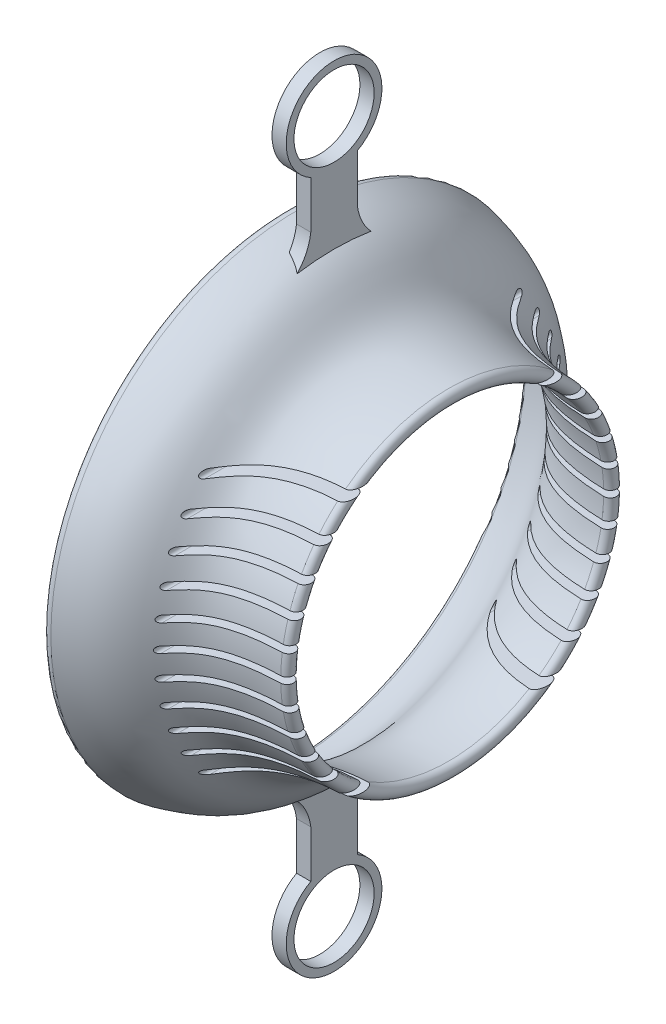
from build123d import *

# Parameters (mm, degrees)
REVOLVE1_OUTLINE_W      = 2.435977989
REVOLVE1_OUTLINE_H      = 0.562148767
REVOLVE1_OUTLINE_W_2    = 2.499054311
REVOLVE1_OUTLINE_H_2    = 0.068757178
SKETCH2_R               = 7.75
BOSS_EXTRUDE1_DEPTH     = 1.375
CUT_EXTRUDE1_DEPTH      = 178.547385118
CUT_EXTRUDE1_DEPTH_BACK = 178.547385118


# Read off the part's stored shape, not the designer's step: Revolve1
with BuildPart() as part:
    # Revolve1 outline → Revolve1 (revolve)
    with BuildSketch(Plane(origin=(0, 42.196632642, 0), x_dir=(0, 1, 0), z_dir=(0, 0, -1))):
        with BuildLine():
            Line((47.435977989, 29.5), (45, 29.5))
            ThreePointArc((45, 29.5), (45.439799744, 28.802850744), (46.217988994, 28.531074384))
            ThreePointArc((46.217988994, 28.531074384), (46.996178245, 28.802850744), (47.435977989, 29.5))
        make_face()
        with Locations((46.217988995, 29.781074384)):
            Rectangle(REVOLVE1_OUTLINE_W, REVOLVE1_OUTLINE_H)
        with BuildLine():
            add(Edge.make_bspline(
                [(45, 29.5), (44.967619341, 29.64031619), (44.934939862, 29.780863156), (44.901881306, 29.921512917), (44.868369225, 30.062148767)],
                knots=[0, 0, 0, 0, 0, 0.021587106, 0.021587106, 0.021587106, 0.021587106, 0.021587106], degree=4))
            Line((45, 29.5), (45, 30.062148767))
            Line((45, 30.062148767), (44.868369225, 30.062148767))
        make_face()
        with BuildLine():
            add(Edge.make_bspline(
                [(44.868369225, 30.062148767), (43.671503185, 35.084882868), (41.896155733, 40.089872991), (36.150916363, 39.760600145), (32.499054311, 47.12340222)],
                knots=[0.021587106, 0.021587106, 0.021587106, 0.021587106, 0.021587106, 0.792559045, 0.792559045, 0.792559045, 0.792559045, 0.792559045], degree=4))
            Line((44.868369225, 30.062148767), (45, 30.062148767))
            Line((45, 30.062148767), (45, 36.895785477))
            add(Edge.make_bspline(
                [(32.500991417, 59.5), (32.512462881, 59.102110558), (32.545797682, 58.269052785), (32.645824483, 56.726958765), (32.83403897, 54.944805828), (33.141937566, 53.088067614), (33.642616847, 50.939980903), (34.401653884, 48.806032662), (35.435939492, 46.898644089), (36.551283461, 45.424962453), (38.13715071, 43.801918002), (40.300334427, 42.092629768), (42.931490645, 39.847261346), (44.396824762, 37.927596666), (45, 36.895785477)],
                knots=[0.000851873, 0.000851873, 0.000851873, 0.000851873, 0.015625, 0.03125, 0.0625, 0.09375, 0.125, 0.1875, 0.25, 0.3125, 0.375, 0.5, 0.625, 0.747925865, 0.747925865, 0.747925865, 0.747925865], degree=3))
            Line((32.500991417, 59.5), (32.499054311, 59.5))
            Line((32.499054311, 59.5), (32.499054311, 47.12340222))
        make_face()
        with BuildLine():
            Line((47.435977989, 30.062148767), (47.435977989, 29.5))
            ThreePointArc((47.435977989, 29.5), (47.45996046, 29.639628711), (47.467988994, 29.781074384))
            ThreePointArc((47.467988994, 29.781074384), (47.45996046, 29.922520056), (47.435977989, 30.062148767))
        make_face()
        with BuildLine():
            Line((45, 36.895785477), (45, 30.062148767))
            Line((45, 30.062148767), (47.435977989, 30.062148767))
            add(Edge.make_bspline(
                [(45, 36.895785477), (45.010177411, 36.878375668), (45.631555726, 35.81034931), (46.360443593, 34.090145), (47.037288625, 31.751965256), (47.304651212, 30.631231468), (47.435977989, 30.062148767)],
                knots=[0.747925865, 0.747925865, 0.747925865, 0.747925865, 0.75, 0.875, 0.9375, 1, 1, 1, 1], degree=3))
        make_face()
        with BuildLine():
            add(Edge.make_bspline(
                [(32.499054311, 47.12340222), (31.516468937, 49.104468734), (30.685434763, 51.642407231), (30.124058518, 54.99095841), (30, 59.5)],
                knots=[0.792559045, 0.792559045, 0.792559045, 0.792559045, 0.792559045, 1, 1, 1, 1, 1], degree=4))
            Line((32.499054311, 47.12340222), (32.499054311, 59.5))
            Line((32.499054311, 59.5), (30, 59.5))
        make_face()
        with Locations((31.249527156, 59.534378589)):
            Rectangle(REVOLVE1_OUTLINE_W_2, REVOLVE1_OUTLINE_H_2)
        with BuildLine():
            ThreePointArc((30, 59.568757178), (29.999527156, 59.534378589), (30, 59.5))
            Line((30, 59.5), (30, 59.568757178))
        make_face()
        with BuildLine():
            Line((32.499054311, 59.568757178), (32.499054311, 59.5))
            Line((32.499054311, 59.5), (32.500991417, 59.5))
            add(Edge.make_bspline(
                [(32.499054311, 59.568757178), (32.499684167, 59.545864368), (32.50032993, 59.522943766), (32.500991417, 59.5)],
                knots=[0, 0, 0, 0, 0.000851873, 0.000851873, 0.000851873, 0.000851873], degree=3))
        make_face()
        with BuildLine():
            ThreePointArc((31.249527156, 60.784378588), (30.377883087, 60.430334289), (30, 59.568757178))
            Line((30, 59.568757178), (32.499054311, 59.568757178))
            ThreePointArc((32.499054311, 59.568757178), (32.121171224, 60.43033429), (31.249527156, 60.784378588))
        make_face()
    revolve(axis=Axis((0, 42.196632642, 0), (1, 0, 0)))

    # Sketch2 → Boss-Extrude1 (add, symmetric)
    # profile 1 of 2: a face of its own
    with BuildSketch(Plane(origin=(36, 0, 0), x_dir=(0, 0, -1), z_dir=(1, 0, 0))):
        with BuildLine():
            Line((4.5, 91.975938839), (4.5, 101.115017705))
            ThreePointArc((4.5, 101.115017705), (0, 118.446632642), (-4.5, 101.115017705))
            Line((-4.5, 101.115017705), (-4.5, 91.975938839))
            ThreePointArc((-4.5, 91.975938839), (-6.073090554, 87.685507916), (-9.39067779, 84.542893347))
            ThreePointArc((-9.39067779, 84.542893347), (0, 85.571632642), (9.39067779, 84.542893347))
            ThreePointArc((9.39067779, 84.542893347), (6.073090554, 87.685507916), (4.5, 91.975938839))
        make_face()
        with Locations((0, 109.196632642)):
            Circle(SKETCH2_R, mode=Mode.SUBTRACT)
    # profile 2 of 2: a face of its own
    with BuildSketch(Plane(origin=(36, 0, 0), x_dir=(0, 0, -1), z_dir=(1, 0, 0))):
        with BuildLine():
            Line((4.5, -16.72175242), (4.5, -7.582673554))
            ThreePointArc((4.5, -7.582673554), (6.073090554, -3.292242631), (9.39067779, -0.149628062))
            ThreePointArc((9.39067779, -0.149628062), (0, -1.178367358), (-9.39067779, -0.149628062))
            ThreePointArc((-9.39067779, -0.149628062), (-6.073090554, -3.292242631), (-4.5, -7.582673554))
            Line((-4.5, -7.582673554), (-4.5, -16.72175242))
            ThreePointArc((-4.5, -16.72175242), (0, -34.053367358), (4.5, -16.72175242))
        make_face()
        with Locations((0, -24.803367358)):
            Circle(SKETCH2_R, mode=Mode.SUBTRACT)
    extrude(amount=BOSS_EXTRUDE1_DEPTH, both=True)

    # Sketch3 → Cut-Extrude1 (cut, two sides: drawn at the far end of the back side and taken through both)
    with BuildSketch(Plane.XY.offset(70).offset(-CUT_EXTRUDE1_DEPTH_BACK)):
        with BuildLine():
            Line((43, 42.822578331), (67.752985617, 42.822578331))
            ThreePointArc((67.752985617, 42.822578331), (68.377985617, 42.197578331), (67.752985617, 41.572578331))
            Line((67.752985617, 41.572578331), (43, 41.572578331))
            ThreePointArc((43, 41.572578331), (42.375, 42.197578331), (43, 42.822578331))
        make_face()
        with BuildLine():
            Line((43, 47.822578331), (67.752985617, 47.822578331))
            ThreePointArc((67.752985617, 47.822578331), (68.377985617, 47.197578331), (67.752985617, 46.572578331))
            Line((67.752985617, 46.572578331), (43, 46.572578331))
            ThreePointArc((43, 46.572578331), (42.375, 47.197578331), (43, 47.822578331))
        make_face()
        with BuildLine():
            Line((43, 52.822578331), (67.752985617, 52.822578331))
            ThreePointArc((67.752985617, 52.822578331), (68.377985617, 52.197578331), (67.752985617, 51.572578331))
            Line((67.752985617, 51.572578331), (43, 51.572578331))
            ThreePointArc((43, 51.572578331), (42.375, 52.197578331), (43, 52.822578331))
        make_face()
        with BuildLine():
            Line((43, 57.822578331), (67.752985617, 57.822578331))
            ThreePointArc((67.752985617, 57.822578331), (68.377985617, 57.197578331), (67.752985617, 56.572578331))
            Line((67.752985617, 56.572578331), (43, 56.572578331))
            ThreePointArc((43, 56.572578331), (42.375, 57.197578331), (43, 57.822578331))
        make_face()
        with BuildLine():
            Line((43, 62.822578331), (67.752985617, 62.822578331))
            ThreePointArc((67.752985617, 62.822578331), (68.377985617, 62.197578331), (67.752985617, 61.572578331))
            Line((67.752985617, 61.572578331), (43, 61.572578331))
            ThreePointArc((43, 61.572578331), (42.375, 62.197578331), (43, 62.822578331))
        make_face()
        with BuildLine():
            Line((43, 67.822578331), (67.752985617, 67.822578331))
            ThreePointArc((67.752985617, 67.822578331), (68.377985617, 67.197578331), (67.752985617, 66.572578331))
            Line((67.752985617, 66.572578331), (43, 66.572578331))
            ThreePointArc((43, 66.572578331), (42.375, 67.197578331), (43, 67.822578331))
        make_face()
        with BuildLine():
            Line((43, 16.572578331), (67.752985617, 16.572578331))
            ThreePointArc((67.752985617, 16.572578331), (68.377985617, 17.197578331), (67.752985617, 17.822578331))
            Line((67.752985617, 17.822578331), (43, 17.822578331))
            ThreePointArc((43, 17.822578331), (42.375, 17.197578331), (43, 16.572578331))
        make_face()
        with BuildLine():
            Line((43, 21.572578331), (67.752985617, 21.572578331))
            ThreePointArc((67.752985617, 21.572578331), (68.377985617, 22.197578331), (67.752985617, 22.822578331))
            Line((67.752985617, 22.822578331), (43, 22.822578331))
            ThreePointArc((43, 22.822578331), (42.375, 22.197578331), (43, 21.572578331))
        make_face()
        with BuildLine():
            Line((43, 26.572578331), (67.752985617, 26.572578331))
            ThreePointArc((67.752985617, 26.572578331), (68.377985617, 27.197578331), (67.752985617, 27.822578331))
            Line((67.752985617, 27.822578331), (43, 27.822578331))
            ThreePointArc((43, 27.822578331), (42.375, 27.197578331), (43, 26.572578331))
        make_face()
        with BuildLine():
            Line((43, 31.572578331), (67.752985617, 31.572578331))
            ThreePointArc((67.752985617, 31.572578331), (68.377985617, 32.197578331), (67.752985617, 32.822578331))
            Line((67.752985617, 32.822578331), (43, 32.822578331))
            ThreePointArc((43, 32.822578331), (42.375, 32.197578331), (43, 31.572578331))
        make_face()
        with BuildLine():
            Line((43, 36.572578331), (67.752985617, 36.572578331))
            ThreePointArc((67.752985617, 36.572578331), (68.377985617, 37.197578331), (67.752985617, 37.822578331))
            Line((67.752985617, 37.822578331), (43, 37.822578331))
            ThreePointArc((43, 37.822578331), (42.375, 37.197578331), (43, 36.572578331))
        make_face()
    extrude(amount=CUT_EXTRUDE1_DEPTH + CUT_EXTRUDE1_DEPTH_BACK, mode=Mode.SUBTRACT)


solid = part.part
